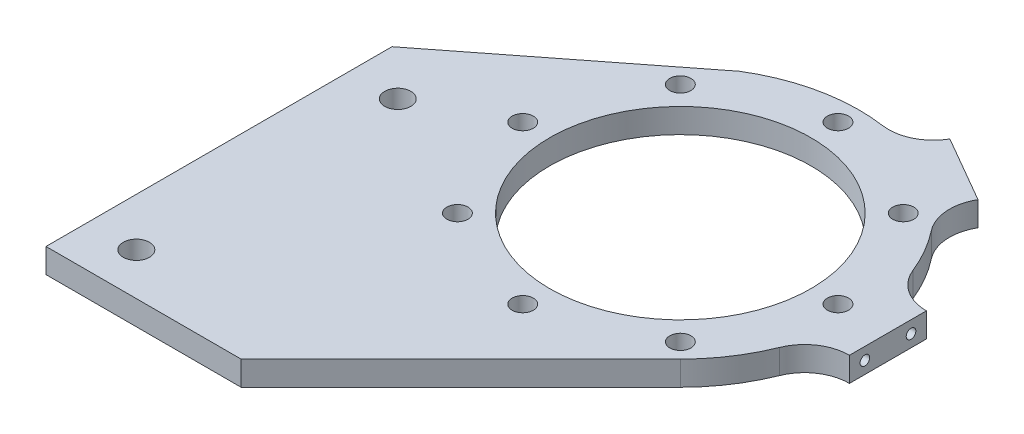
from build123d import *

# Parameters (mm, degrees)
BASE_FLANGE1_DEPTH = 6.35
SKETCH8_R          = 3.4
CUT_EXTRUDE1_DEPTH = 183.851914127
SKETCH9_R          = 34
CUT_EXTRUDE2_DEPTH = 183.851914127
SKETCH10_R         = 2.75
CUT_EXTRUDE3_DEPTH = 183.851914127
TABS_1_START       = -6.35
TABS_1_DEPTH       = 6.35
TABS_2_AT_2_COUNT  = 2
TABS_2_AT_2_PITCH  = 12
CIRPATTERN2_COUNT  = 2
CIRPATTERN2_ANGLE  = 60


# Sheet-metal steps are written as plain solids
with BuildPart() as part:
    # Sketch2 → Base-Flange1 (new body)
    with BuildSketch(Plane(origin=(0, 0, 0), x_dir=(1, 0, 0), z_dir=(0, 1, 0))):
        with BuildLine():
            Line((0, 0), (50.76093065, 0))
            Line((50.76093065, 0), (107.880465325, 57.119534675))
            ThreePointArc((107.880465325, 57.119534675), (111.537953618, 118.761570635), (50.76093065, 129.682710556))
            Line((50.76093065, 129.682710556), (0, 90))
            Line((0, 90), (0, 0))
        make_face()
    extrude(amount=-BASE_FLANGE1_DEPTH)

    # Sketch8 → Cut-Extrude1 (cut, through all)
    with BuildSketch(Plane(origin=(0, 0, 0), x_dir=(1, 0, 0), z_dir=(0, 1, 0))):
        with Locations(Location((12.5, 79, 0), (0, 0, 270))):
            Circle(SKETCH8_R)
        with Locations(Location((12.5, 11, 0), (0, 0, 90))):
            Circle(SKETCH8_R)
    extrude(amount=-CUT_EXTRUDE1_DEPTH, mode=Mode.SUBTRACT)

    # Sketch9 → Cut-Extrude2 (cut, through all)
    with BuildSketch(Plane(origin=(0, 0, 0), x_dir=(1, 0, 0), z_dir=(0, 1, 0))):
        with Locations(Location((75, 90, 0), (0, 0, 270))):
            Circle(SKETCH9_R)
    extrude(amount=-CUT_EXTRUDE2_DEPTH, mode=Mode.SUBTRACT)

    # Sketch10 → Cut-Extrude3 (cut, through all)
    with BuildSketch(Plane(origin=(0, 0, 0), x_dir=(1, 0, 0), z_dir=(0, 1, 0))):
        with Locations(Location((75, 131, 0), (0, 0, 270))):
            Circle(SKETCH10_R)
        with Locations(Location((103.991378029, 118.991378029, 0), (0, 0, 270))):
            Circle(SKETCH10_R)
        with Locations(Location((116, 90, 0), (0, 0, 270))):
            Circle(SKETCH10_R)
        with Locations(Location((103.991378029, 61.008621971, 0), (0, 0, 270))):
            Circle(SKETCH10_R)
        with Locations(Location((75, 49, 0), (0, 0, 270))):
            Circle(SKETCH10_R)
        with Locations(Location((46.008621971, 61.008621971, 0), (0, 0, 270))):
            Circle(SKETCH10_R)
        with Locations(Location((34, 90, 0), (0, 0, 270))):
            Circle(SKETCH10_R)
        with Locations(Location((46.008621971, 118.991378029, 0), (0, 0, 270))):
            Circle(SKETCH10_R)
    extrude(amount=-CUT_EXTRUDE3_DEPTH, mode=Mode.SUBTRACT)

    # Sketch11 → Tabs_1 (add)
    with BuildSketch(Plane.XZ.offset(6.35).offset(TABS_1_START)):
        with BuildLine():
            Line((129, -100), (129, -80))
            ThreePointArc((129, -80), (122.450687881, -77.994187792), (118.147884423, -72.66477373))
            ThreePointArc((118.147884423, -72.66477373), (121.5, -90), (118.147884423, -107.33522627))
            ThreePointArc((118.147884423, -107.33522627), (122.450687881, -102.005812208), (129, -100))
        make_face()
    tabs_1 = extrude(amount=TABS_1_DEPTH)

    # Sketch20 → Tabs_2 (revolve, cut)
    with BuildSketch(Plane(origin=(129, -3.175, -84), x_dir=(0, 0, -1), z_dir=(0, 1, 0))):
        Polygon((0, 0), (0, 5.751075774), (1.25, 5), (1.25, 0), align=None)
    tabs_2 = revolve(axis=Axis((135.35, -3.175, -84), (-1, 0, 0)), mode=Mode.SUBTRACT)

    # Tabs_2 at 2: Tabs_2 ×2
    with Locations(*[(0, 0, -i * TABS_2_AT_2_PITCH) for i in range(1, TABS_2_AT_2_COUNT)]):
        add(tabs_2, mode=Mode.SUBTRACT)

    # CirPattern2: Tabs_1, Tabs_2 ×2 about axis
    cirpattern2_axis = Axis((75, 0, -90), (0, 1, 0))
    add([tabs_1.rotate(cirpattern2_axis, i * CIRPATTERN2_ANGLE / (CIRPATTERN2_COUNT - 1)) for i in range(1, CIRPATTERN2_COUNT)])
    add([tabs_2.rotate(cirpattern2_axis, i * CIRPATTERN2_ANGLE / (CIRPATTERN2_COUNT - 1)) for i in range(1, CIRPATTERN2_COUNT)], mode=Mode.SUBTRACT)

    # CirPattern2 copy 1 sketch → CirPattern2 copy 1 (revolve, cut)
    with BuildSketch(Plane(origin=(96.803847577, -3.175, -139.765371804), x_dir=(-0.8660254037844399, 0, -0.4999999999999978), z_dir=(0, 1, 0))):
        Polygon((0, 0), (0, 5.751075774), (1.25, 5), (1.25, 0), align=None)
    revolve(axis=Axis((99.978847577, -3.175, -145.264633118), (-0.4999999999999978, 0, 0.8660254037844399)), mode=Mode.SUBTRACT)


solid = part.part
